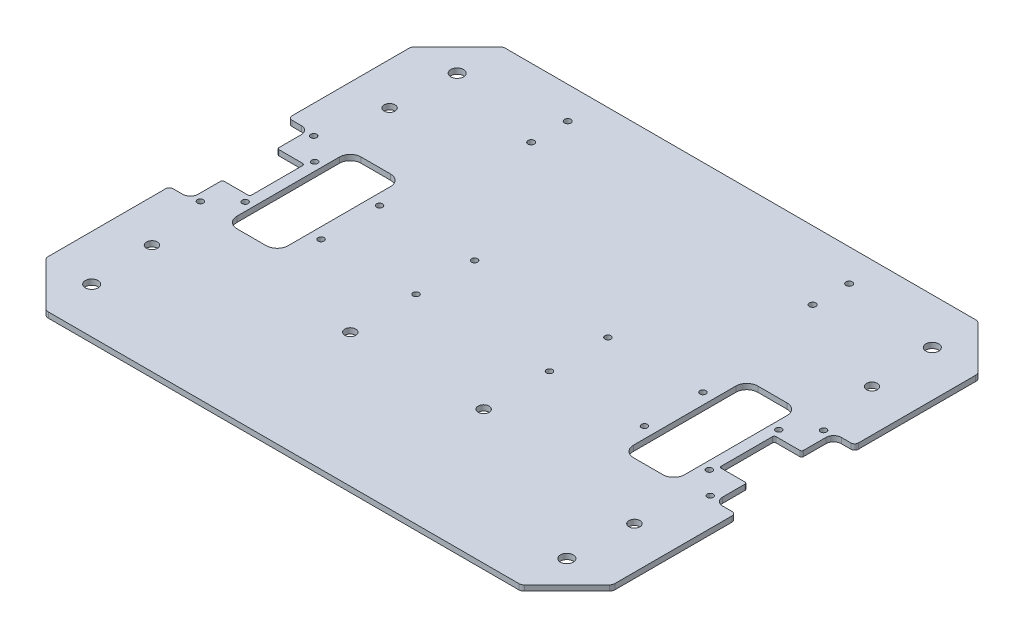
from build123d import *

# Parameters (mm, degrees)
BOSS_EXTRU_1_DEPTH         = 3
CONG_1_R                   = 3
ESQUISSE2_R                = 3
PER_AGE_PROFIL_DEPTH       = 200.145675323
ESQUISSE3_R                = 1.65
PER_AGE_ENCODEUR_DEPTH     = 200.145675323
POCHE_ROUE_ENCODEUSE_DEPTH = 200.145675323
CONG_4_R                   = 1
CONG_2_R                   = 4.25
CONG_3_R                   = 4.25
ESQUISSE5_R                = 1.65
PER_AGE_BLOC_MOTEUR_DEPTH  = 200.145675323
ESQUISSE6_W                = 28
ESQUISSE6_H                = 68
POCHE_ROUE_MOTRICE_DEPTH   = 200.145675323
ESQUISSE7_R                = 3.5
PER_AGE_PATIN_DEPTH        = 200.145675323
ESQUISSE8_R                = 3
ENL_V_MAT_EXTRU_1_DEPTH    = 200.145675323
CONG_5_R                   = 6
ENL_V_MAT_EXTRU_2_REACH    = 201.146
ESQUISSE9_W                = 7.25
ESQUISSE9_H                = 65
CONG_6_R                   = 2
ESQUISSE10_R               = 1.75
ENL_V_MAT_EXTRU_3_DEPTH    = 200.145675323


with BuildPart() as part:
    # Esquisse1 → Boss.-Extru.1 (new body)
    with BuildSketch(Plane(origin=(0, 0, 0), x_dir=(1, 0, 0), z_dir=(0, 1, 0))):
        Polygon((-130, 125), (130, 125), (155, 100), (155, -100), (130, -125), (-130, -125), (-155, -100), (-155, 100), align=None)
    extrude(amount=BOSS_EXTRU_1_DEPTH)

    # Congé1
    cong_1_edges = [part.edges().sort_by_distance(p)[0] for p in [
        (155, 1.5, -100),
        (155, 1.5, 100),
        (130, 1.5, 125),
        (-130, 1.5, 125),
        (-155, 1.5, 100),
        (-155, 1.5, -100),
        (-130, 1.5, -125),
        (130, 1.5, -125),
    ]]
    fillet(cong_1_edges, radius=CONG_1_R)

    # Esquisse2 → Perçage Profilé (cut, through all)
    with BuildSketch(Plane(origin=(0, 3, 0), x_dir=(1, 0, 0), z_dir=(0, 1, 0))):
        with Locations(Location((-132, -65, 0), (0, 0, 270))):
            Circle(ESQUISSE2_R)
        with Locations(Location((-132, 65, 0), (0, 0, 90))):
            Circle(ESQUISSE2_R)
        with Locations(Location((132, -65, 0), (0, 0, 90))):
            Circle(ESQUISSE2_R)
        with Locations(Location((132, 65, 0), (0, 0, 270))):
            Circle(ESQUISSE2_R)
    extrude(amount=-PER_AGE_PROFIL_DEPTH, mode=Mode.SUBTRACT)

    # Esquisse3 → Perçage Encodeur (cut, through all)
    with BuildSketch(Plane(origin=(0, 3, 0), x_dir=(1, 0, 0), z_dir=(0, 1, 0))):
        with Locations(Location((-127, 19, 0), (0, 0, 270))):
            Circle(ESQUISSE3_R)
        with Locations(Location((-127, -19, 0), (0, 0, 270))):
            Circle(ESQUISSE3_R)
        with Locations(Location((127, -19, 0), (0, 0, 90))):
            Circle(ESQUISSE3_R)
        with Locations(Location((127, 19, 0), (0, 0, 90))):
            Circle(ESQUISSE3_R)
        with Locations(Location((-139.5, 31, 0), (0, 0, 270))):
            Circle(ESQUISSE3_R)
        with Locations(Location((-139.5, -31, 0), (0, 0, 270))):
            Circle(ESQUISSE3_R)
        with Locations(Location((139.5, -31, 0), (0, 0, 90))):
            Circle(ESQUISSE3_R)
        with Locations(Location((139.5, 31, 0), (0, 0, 90))):
            Circle(ESQUISSE3_R)
    extrude(amount=-PER_AGE_ENCODEUR_DEPTH, mode=Mode.SUBTRACT)

    # Esquisse4 → Poche Roue Encodeuse (cut, through all)
    with BuildSketch(Plane(origin=(0, 3, 0), x_dir=(1, 0, 0), z_dir=(0, 1, 0))):
        with BuildLine():
            Line((143.5, -15), (129.5, -15))
            ThreePointArc((129.5, -15), (128.792893219, -14.707106781), (128.5, -14))
            Line((128.5, -14), (128.5, 14))
            ThreePointArc((128.5, 14), (128.792893219, 14.707106781), (129.5, 15))
            Line((129.5, 15), (143.5, 15))
            Line((143.5, 15), (143.5, 32.5))
            Line((143.5, 32.5), (152, 32.5))
            Line((152, 32.5), (152, -32.5))
            Line((152, -32.5), (143.5, -32.5))
            Line((143.5, -32.5), (143.5, -15))
        make_face()
        with BuildLine():
            Line((-128.5, -14), (-128.5, 14))
            ThreePointArc((-128.5, 14), (-128.792893219, 14.707106781), (-129.5, 15))
            Line((-129.5, 15), (-143.5, 15))
            Line((-143.5, 15), (-143.5, 32.5))
            Line((-143.5, 32.5), (-152, 32.5))
            Line((-152, 32.5), (-152, -32.5))
            Line((-152, -32.5), (-143.5, -32.5))
            Line((-143.5, -32.5), (-143.5, -15))
            Line((-143.5, -15), (-129.5, -15))
            ThreePointArc((-129.5, -15), (-128.792893219, -14.707106781), (-128.5, -14))
        make_face()
    extrude(amount=-POCHE_ROUE_ENCODEUSE_DEPTH, mode=Mode.SUBTRACT)

    # Congé4
    cong_4_edges = [part.edges().sort_by_distance(p)[0] for p in [
        (-143.5, 1.5, 15),
        (-143.5, 1.5, -15),
        (143.5, 1.5, -15),
        (143.5, 1.5, 15),
    ]]
    fillet(cong_4_edges, radius=CONG_4_R)

    # Congé2
    cong_2_edges = [part.edges().sort_by_distance(p)[0] for p in [
        (-152, 1.5, 32.5),
        (-152, 1.5, -32.5),
        (152, 1.5, -32.5),
        (152, 1.5, 32.5),
    ]]
    fillet(cong_2_edges, radius=CONG_2_R)

    # Congé3
    cong_3_edges = [part.edges().sort_by_distance(p)[0] for p in [
        (143.5, 1.5, 32.5),
        (143.5, 1.5, -32.5),
        (-143.5, 1.5, 32.5),
        (-143.5, 1.5, -32.5),
    ]]
    fillet(cong_3_edges, radius=CONG_3_R - 0.0001)  # a hair under: the kernel refuses the full size

    # Esquisse5 → Perçage Bloc Moteur (cut, through all)
    with BuildSketch(Plane(origin=(0, 3, 0), x_dir=(1, 0, 0), z_dir=(0, 1, 0))):
        with Locations(Location((-88.5, 16, 0), (0, 0, 270))):
            Circle(ESQUISSE5_R)
        with Locations(Location((-88.5, -16, 0), (0, 0, 270))):
            Circle(ESQUISSE5_R)
        with Locations(Location((-36.5, -16, 0), (0, 0, 270))):
            Circle(ESQUISSE5_R)
        with Locations(Location((-36.5, 16, 0), (0, 0, 270))):
            Circle(ESQUISSE5_R)
        with Locations(Location((36.5, 16, 0), (0, 0, 90))):
            Circle(ESQUISSE5_R)
        with Locations(Location((36.5, -16, 0), (0, 0, 90))):
            Circle(ESQUISSE5_R)
        with Locations(Location((88.5, -16, 0), (0, 0, 90))):
            Circle(ESQUISSE5_R)
        with Locations(Location((88.5, 16, 0), (0, 0, 90))):
            Circle(ESQUISSE5_R)
    extrude(amount=-PER_AGE_BLOC_MOTEUR_DEPTH, mode=Mode.SUBTRACT)

    # Esquisse6 → Poche Roue Motrice (cut, through all)
    with BuildSketch(Plane(origin=(0, 3, 0), x_dir=(1, 0, 0), z_dir=(0, 1, 0))):
        with Locations((-108.5, 0)):
            Rectangle(ESQUISSE6_W, ESQUISSE6_H)
        with Locations((108.5, 0)):
            Rectangle(ESQUISSE6_W, ESQUISSE6_H)
    extrude(amount=-POCHE_ROUE_MOTRICE_DEPTH, mode=Mode.SUBTRACT)

    # Esquisse7 → Perçage Patin (cut, through all)
    with BuildSketch(Plane(origin=(0, 3, 0), x_dir=(1, 0, 0), z_dir=(0, 1, 0))):
        with Locations(Location((-130, 100, 0), (0, 0, 270))):
            Circle(ESQUISSE7_R)
        with Locations(Location((-130, -100, 0), (0, 0, 90))):
            Circle(ESQUISSE7_R)
        with Locations(Location((130, -100, 0), (0, 0, 270))):
            Circle(ESQUISSE7_R)
        with Locations(Location((130, 100, 0), (0, 0, 90))):
            Circle(ESQUISSE7_R)
    extrude(amount=-PER_AGE_PATIN_DEPTH, mode=Mode.SUBTRACT)

    # Esquisse8 → Enlèv. mat.-Extru.1 (cut, through all)
    with BuildSketch(Plane(origin=(0, 3, 0), x_dir=(1, 0, 0), z_dir=(0, 1, 0))):
        with Locations(Location((-36.5, -52, 0), (0, 0, 270))):
            Circle(ESQUISSE8_R)
        with Locations(Location((36.5, -52, 0), (0, 0, 270))):
            Circle(ESQUISSE8_R)
    extrude(amount=-ENL_V_MAT_EXTRU_1_DEPTH, mode=Mode.SUBTRACT)

    # Congé5
    cong_5_edges = [part.edges().sort_by_distance(p)[0] for p in [
        (-122.5, 1.5, 34),
        (-122.5, 1.5, -34),
        (-94.5, 1.5, -34),
        (-94.5, 1.5, 34),
        (122.5, 1.5, -34),
        (122.5, 1.5, 34),
        (94.5, 1.5, 34),
        (94.5, 1.5, -34),
    ]]
    fillet(cong_5_edges, radius=CONG_5_R)

    # Esquisse9 → Enlèv. mat.-Extru.2 (cut, up to next)
    with BuildSketch(Plane(origin=(0, 3, 0), x_dir=(1, 0, 0), z_dir=(0, 1, 0)), mode=Mode.PRIVATE) as enl_v_mat_extru_2_sk1:
        with Locations((-151.375, 0)):
            Rectangle(ESQUISSE9_W, ESQUISSE9_H)
    enl_v_mat_extru_2_tool1 = extrude(enl_v_mat_extru_2_sk1.sketch, amount=-ENL_V_MAT_EXTRU_2_REACH, mode=Mode.PRIVATE) & part.part
    # Esquisse9 → Enlèv. mat.-Extru.2 (cut, up to next)
    with BuildSketch(Plane(origin=(0, 3, 0), x_dir=(1, 0, 0), z_dir=(0, 1, 0)), mode=Mode.PRIVATE) as enl_v_mat_extru_2_sk2:
        with Locations((151.375, 0)):
            Rectangle(ESQUISSE9_W, ESQUISSE9_H)
    enl_v_mat_extru_2_tool2 = extrude(enl_v_mat_extru_2_sk2.sketch, amount=-ENL_V_MAT_EXTRU_2_REACH, mode=Mode.PRIVATE) & part.part
    add(enl_v_mat_extru_2_tool1.solids().sort_by_distance((-151.375, 3, 0))[0], mode=Mode.SUBTRACT)
    add(enl_v_mat_extru_2_tool2.solids().sort_by_distance((151.375, 3, 0))[0], mode=Mode.SUBTRACT)

    # Congé6
    cong_6_edges = [part.edges().sort_by_distance(p)[0] for p in [
        (-155, 1.5, 32.5),
        (-155, 1.5, -32.5),
        (155, 1.5, -32.5),
        (155, 1.5, 32.5),
    ]]
    fillet(cong_6_edges, radius=CONG_6_R)

    # Esquisse10 → Enlèv. mat.-Extru.3 (cut, through all)
    with BuildSketch(Plane(origin=(0, 3, 0), x_dir=(1, 0, 0), z_dir=(0, 1, 0))):
        with Locations(Location((77, 107.5, 0), (0, 0, 270))):
            Circle(ESQUISSE10_R)
        with Locations(Location((77, 87.5, 0), (0, 0, 270))):
            Circle(ESQUISSE10_R)
        with Locations(Location((-77, 87.5, 0), (0, 0, 90))):
            Circle(ESQUISSE10_R)
        with Locations(Location((-77, 107.5, 0), (0, 0, 90))):
            Circle(ESQUISSE10_R)
    extrude(amount=-ENL_V_MAT_EXTRU_3_DEPTH, mode=Mode.SUBTRACT)


solid = part.part
